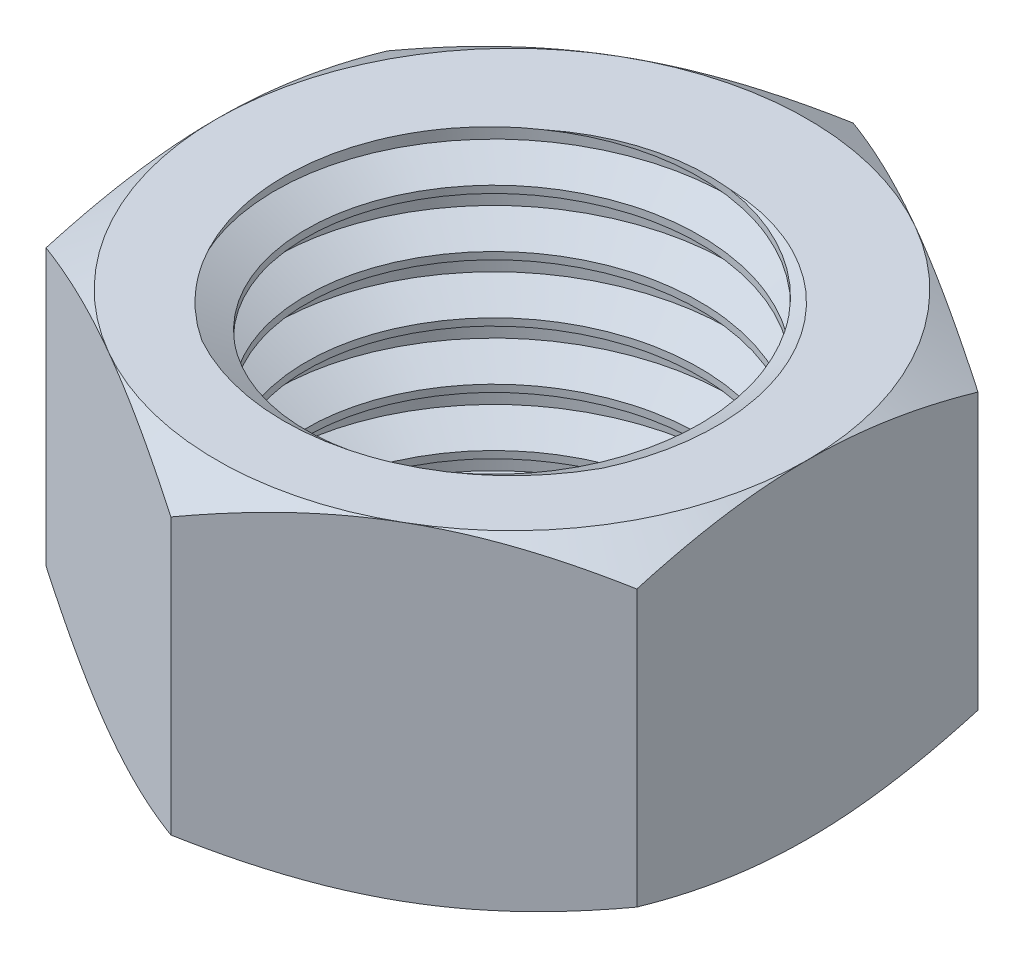
from build123d import *

# Parameters (mm, degrees)
BOSS_EXTRUDE2_DEPTH = 10
SKETCH18_R          = 6
CUT_EXTRUDE1_DEPTH  = 18
SKETCH20_OUTSIDE_W  = 63.264
SKETCH20_OUTSIDE_H  = 66.048
SKETCH20_OUTSIDE_R  = 9
CUT_EXTRUDE4_DEPTH  = 10.8
CUT_EXTRUDE4_DRAFT  = -60
SKETCH21_OUTSIDE_W  = 63.264
SKETCH21_OUTSIDE_H  = 66.048
SKETCH21_OUTSIDE_R  = 9
CUT_EXTRUDE5_DEPTH  = 10.8
CUT_EXTRUDE5_DRAFT  = -60
THREAD3_PITCH       = 1.75


with BuildPart() as part:
    # Sketch1 → Boss-Extrude2 (new body)
    with BuildSketch(Plane(origin=(0, 0, 0), x_dir=(1, 0, 0), z_dir=(0, 1, 0))):
        Polygon((0, 10.392304845), (-9, 5.196152423), (-9, -5.196152423), (0, -10.392304845), (9, -5.196152423), (9, 5.196152423), align=None)
    extrude(amount=BOSS_EXTRUDE2_DEPTH)

    # Sketch18 → Cut-Extrude1 (cut, through all)
    with BuildSketch(Plane(origin=(0, 10, 0), x_dir=(1, 0, 0), z_dir=(0, 1, 0))):
        with Locations(Location((0, 0, 0), (0, 0, 270))):
            Circle(SKETCH18_R)
    extrude(amount=-CUT_EXTRUDE1_DEPTH, mode=Mode.SUBTRACT)


with BuildPart() as cut_extrude4_tool:
    # Sketch20 outside → Cut-Extrude4 (with draft: the straight prism first)
    with BuildSketch(Plane.XZ):
        Rectangle(SKETCH20_OUTSIDE_W, SKETCH20_OUTSIDE_H)
        Circle(SKETCH20_OUTSIDE_R, mode=Mode.SUBTRACT)
    extrude(amount=-CUT_EXTRUDE4_DEPTH)
    # Cut-Extrude4: the draft: its side faces are tilted about the plane it starts from
    cut_extrude4_sides = [cut_extrude4_tool.faces().sort_by_distance(p)[0] for p in [
        (0, 5.4, -33.024),
        (31.632, 5.4, 0),
        (0, 5.4, 33.024),
        (-31.632, 5.4, 0),
        (-9, 5.4, 0),
    ]]
    draft(cut_extrude4_sides, Plane.XZ, CUT_EXTRUDE4_DRAFT)


with BuildPart() as part_1:
    add(part.part)

    # Cut-Extrude4: cut by cut_extrude4_tool
    add(cut_extrude4_tool.part, mode=Mode.SUBTRACT)


with BuildPart() as cut_extrude5_tool:
    # Sketch21 outside → Cut-Extrude5 (with draft: the straight prism first)
    with BuildSketch(Plane(origin=(0, 10, 0), x_dir=(1, 0, 0), z_dir=(0, 1, 0))):
        Rectangle(SKETCH21_OUTSIDE_W, SKETCH21_OUTSIDE_H)
        Circle(SKETCH21_OUTSIDE_R, mode=Mode.SUBTRACT)
    extrude(amount=-CUT_EXTRUDE5_DEPTH)
    # Cut-Extrude5: the draft: its side faces are tilted about the plane it starts from
    cut_extrude5_sides = [cut_extrude5_tool.faces().sort_by_distance(p)[0] for p in [
        (0, 4.6, 33.024),
        (31.632, 4.6, 0),
        (0, 4.6, -33.024),
        (-31.632, 4.6, 0),
        (-9, 4.6, 0),
    ]]
    draft(cut_extrude5_sides, Plane(origin=(0, 10, 0), x_dir=(1, 0, 0), z_dir=(0, 1, 0)), CUT_EXTRUDE5_DRAFT)


with BuildPart() as part_2:
    add(part_1.part)

    # Cut-Extrude5: cut by cut_extrude5_tool
    add(cut_extrude5_tool.part, mode=Mode.SUBTRACT)

    # Thread3: the profile of Thread Profile3 profile screwed along a right-hand helix of 6.857143 turns, 10 arcs to a turn; built about Z, then put on its axis
    thread3_z = Axis((0, 0, 0), (0, 0, 1))
    thread3_corners = [(5.9997, 0, -0.000173205), (5.9997, 0, 1.5314232), (6.947215281, 0, 0.984374998), (6.947215281, 0, 0.546874998)]
    with BuildLine(mode=Mode.PRIVATE) as thread3_profile:
        Line(thread3_corners[0], thread3_corners[1])
        Line(thread3_corners[1], thread3_corners[2])
        Line(thread3_corners[2], thread3_corners[3])
        Line(thread3_corners[3], thread3_corners[0])
    thread3_cap = Face(thread3_profile.wire())
    thread3_turn_angles = [0, 18, 36, 54, 72, 90, 108, 126, 144, 162, 180, 198, 216, 234, 252, 270, 288, 306, 324, 342, 360]
    thread3_turn_weights = [1, 0.9510565162951535, 1, 0.9510565162951535, 1, 0.9510565162951535, 1, 0.9510565162951535, 1, 0.9510565162951535, 1, 0.9510565162951535, 1, 0.9510565162951535, 1, 0.9510565162951535, 1, 0.9510565162951535, 1, 0.9510565162951535, 1]
    thread3_turn_rails = [Edge.make_bspline([Vector(p[0], p[1], 0).rotate(thread3_z, thread3_turn_angles[k]) / thread3_turn_weights[k] + Vector(0, 0, p[2] + THREAD3_PITCH * thread3_turn_angles[k] / 360) for k in range(21)], [0, 0, 0, 1, 1, 2, 2, 3, 3, 4, 4, 5, 5, 6, 6, 7, 7, 8, 8, 9, 9, 10, 10, 10], 2, thread3_turn_weights) for p in thread3_corners]
    thread3_turn_sides = [Face.make_surface_from_curves(thread3_turn_rails[p[0]], thread3_turn_rails[p[1]]) for p in [(0, 1), (1, 2), (2, 3), (3, 0)]]
    thread3_last_angles = [2160, 2178, 2196, 2214, 2232, 2250, 2268, 2286, 2304, 2322, 2340, 2358, 2376, 2394, 2412, 2430, 2448, 2458.285714286, 2468.571428571]
    thread3_last_weights = [1, 0.9510565162951535, 1, 0.9510565162951535, 1, 0.9510565162951535, 1, 0.9510565162951535, 1, 0.9510565162951535, 1, 0.9510565162951535, 1, 0.9510565162951535, 1, 0.9510565162951535, 1, 0.9839295885986299, 1]
    thread3_last_rails = [Edge.make_bspline([Vector(p[0], p[1], 0).rotate(thread3_z, thread3_last_angles[k]) / thread3_last_weights[k] + Vector(0, 0, p[2] + THREAD3_PITCH * thread3_last_angles[k] / 360) for k in range(19)], [0, 0, 0, 1, 1, 2, 2, 3, 3, 4, 4, 5, 5, 6, 6, 7, 7, 8, 8, 9, 9, 9], 2, thread3_last_weights) for p in thread3_corners]
    thread3_last_sides = [Face.make_surface_from_curves(thread3_last_rails[p[0]], thread3_last_rails[p[1]]) for p in [(0, 1), (1, 2), (2, 3), (3, 0)]]
    thread3 = Plane(origin=(0, 12, 0), x_dir=(-1, 0, 0), z_dir=(0, -1, 0)) * Solid(Shell([*[p.moved(Location((0, 0, THREAD3_PITCH * i))) for i in range(6) for p in thread3_turn_sides], *thread3_last_sides, thread3_cap, thread3_cap.rotate(thread3_z, 2468.571428571).moved(Location((0, 0, THREAD3_PITCH * 2468.571428571 / 360)))]))
    add(thread3, mode=Mode.SUBTRACT)


solid = part_2.part
